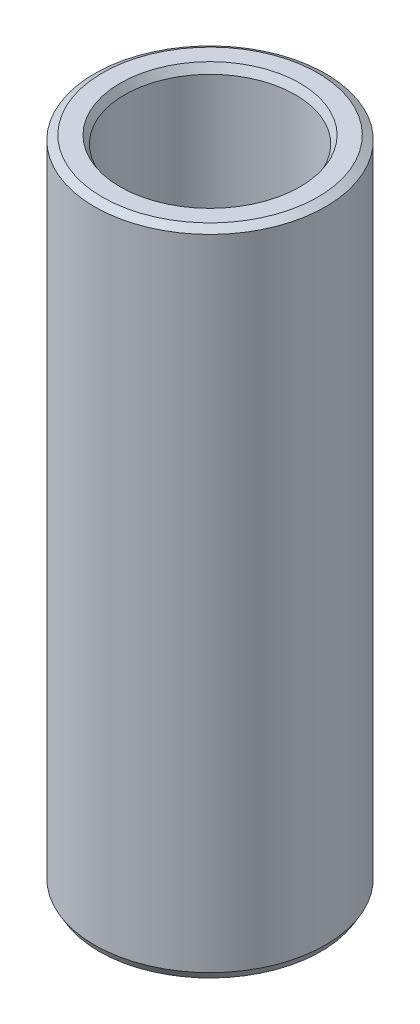
from build123d import *
from OCP.BRepFilletAPI import BRepFilletAPI_MakeChamfer

# Parameters (mm, degrees)
SKETCH1_R           = 55
BOSS_EXTRUDE1_DEPTH = 310.442155114
SKETCH2_R           = 40.671726273
CUT_EXTRUDE1_DEPTH  = 321.038015979
CHAMFER1_SIZE       = 2.141413478
CHAMFER1_SIZE2      = 3.709036945


with BuildPart() as part:
    # Sketch1 → Boss-Extrude1 (new body)
    with BuildSketch(Plane(origin=(0, 0, 0), x_dir=(1, 0, 0), z_dir=(0, 1, 0))):
        Circle(SKETCH1_R)
    extrude(amount=BOSS_EXTRUDE1_DEPTH)

    # Sketch2 → Cut-Extrude1 (cut, through all)
    with BuildSketch(Plane(origin=(0, 0, 0), x_dir=(1, 0, 0), z_dir=(0, 1, 0))):
        Circle(SKETCH2_R)
    extrude(amount=CUT_EXTRUDE1_DEPTH, mode=Mode.SUBTRACT)

    # Chamfer1: one chamfer whose edges measure the first distance from different faces: ONE call of the kernel's chamfer builder (chamfer() names one face for all edges)
    chamfer1_edges_1 = [part.edges().sort_by_distance(p)[0] for p in [
        (-40.671726273, 310.442155114, 0),
    ]]
    chamfer1_side_1 = [part.faces().sort_by_distance(p)[0] for p in [
        (-53.444365081, 310.442155114, 0),
    ]]
    chamfer1_edges_2 = [part.edges().sort_by_distance(p)[0] for p in [
        (-40.671726273, 0, 0),
    ]]
    chamfer1_side_2 = [part.faces().sort_by_distance(p)[0] for p in [
        (-40.671726273, 155.221077557, 0),
    ]]
    chamfer1_edges_3 = [part.edges().sort_by_distance(p)[0] for p in [
        (-55, 0, 0),
    ]]
    chamfer1_side_3 = [part.faces().sort_by_distance(p)[0] for p in [
        (-53.444365081, 0, 0),
    ]]
    chamfer1_edges_4 = [part.edges().sort_by_distance(p)[0] for p in [
        (-55, 310.442155114, 0),
    ]]
    chamfer1_side_4 = [part.faces().sort_by_distance(p)[0] for p in [
        (-55, 155.221077557, 0),
    ]]
    chamfer1 = BRepFilletAPI_MakeChamfer(part.part.solid().wrapped)
    for e in chamfer1_edges_1:
        chamfer1.Add(CHAMFER1_SIZE, CHAMFER1_SIZE2, e.wrapped, chamfer1_side_1[0].wrapped)  # the first distance lies on this face
    for e in chamfer1_edges_2:
        chamfer1.Add(CHAMFER1_SIZE, CHAMFER1_SIZE2, e.wrapped, chamfer1_side_2[0].wrapped)  # the first distance lies on this face
    for e in chamfer1_edges_3:
        chamfer1.Add(CHAMFER1_SIZE, CHAMFER1_SIZE2, e.wrapped, chamfer1_side_3[0].wrapped)  # the first distance lies on this face
    for e in chamfer1_edges_4:
        chamfer1.Add(CHAMFER1_SIZE, CHAMFER1_SIZE2, e.wrapped, chamfer1_side_4[0].wrapped)  # the first distance lies on this face
    add(Compound.cast(chamfer1.Shape()), mode=Mode.REPLACE)


solid = part.part
